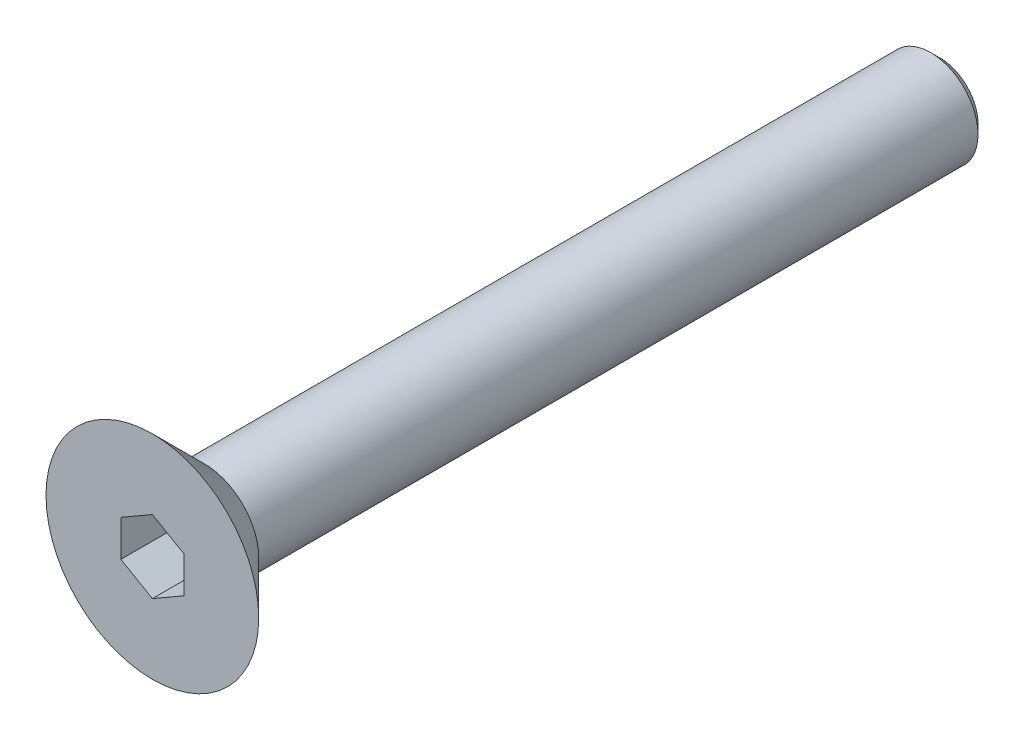
from build123d import *

# Parameters (mm, degrees)
SKETCH1_R           = 3.375
BOSS_EXTRUDE1_DEPTH = 1.65
SKETCH2_R           = 1.5
BOSS_EXTRUDE2_DEPTH = 23.35
CHAMFER1_SIZE       = 0.3
CUT_EXTRUDE1_DEPTH  = 2
CHAMFER2_SIZE       = 1.65


with BuildPart() as part:
    # Sketch1 → Boss-Extrude1 (new body)
    with BuildSketch(Plane.XY):
        Circle(SKETCH1_R)
    extrude(amount=BOSS_EXTRUDE1_DEPTH)

    # Sketch2 → Boss-Extrude2 (add)
    with BuildSketch(Plane(origin=(0, 0, 0), x_dir=(-1, 0, 0), z_dir=(0, 0, -1))):
        with Locations(Location((0, 0, 0), (0, 0, 180))):
            Circle(SKETCH2_R)
    extrude(amount=BOSS_EXTRUDE2_DEPTH)

    # Chamfer1
    chamfer1_edges = [part.edges().sort_by_distance(p)[0] for p in [
        (-1.5, 0, -23.35),
    ]]
    chamfer(chamfer1_edges, length=CHAMFER1_SIZE)

    # Sketch3 → Cut-Extrude1 (cut)
    with BuildSketch(Plane.XY.offset(1.65)):
        Polygon((0, 1.154700538), (-1, 0.577350269), (-1, -0.577350269), (0, -1.154700538), (1, -0.577350269), (1, 0.577350269), align=None)
    extrude(amount=-CUT_EXTRUDE1_DEPTH, mode=Mode.SUBTRACT)

    # Chamfer2
    chamfer2_edges = [part.edges().sort_by_distance(p)[0] for p in [
        (-3.375, 0, 0),
    ]]
    chamfer(chamfer2_edges, length=CHAMFER2_SIZE - 0.0001)  # a hair under: the kernel refuses the full size


solid = part.part
